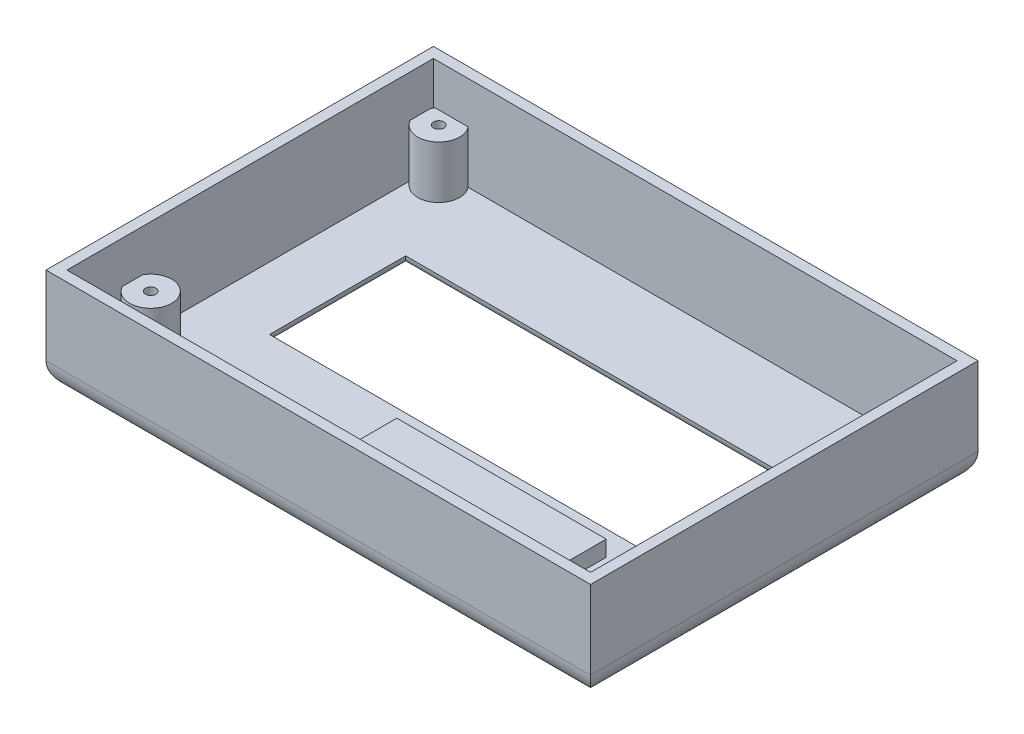
from build123d import *

# Parameters (mm, degrees)
SKETCH1_W           = 104
SKETCH1_H           = 74
SKETCH1_W_2         = 100
SKETCH1_H_2         = 70
BOSS_EXTRUDE2_DEPTH = 20
SKETCH1_3_W         = 100
SKETCH1_3_H         = 70
SKETCH1_3_R         = 5.5
SKETCH1_3_W_2       = 77
SKETCH1_3_H_2       = 26
BOSS_EXTRUDE3_DEPTH = 2
FILLET1_R           = 5
FILLET2_R           = 2
SKETCH3_R           = 4
SKETCH3_R_2         = 1
BOSS_EXTRUDE4_DEPTH = 10
SKETCH4_W           = 40
SKETCH4_H           = 3
BOSS_EXTRUDE5_DEPTH = 15


with BuildPart() as part:
    # Sketch1 → Boss-Extrude2 (new body)
    with BuildSketch(Plane(origin=(0, 0, 0), x_dir=(1, 0, 0), z_dir=(0, 1, 0))):
        with Locations((-31.943816067, -36.302599947)):
            Rectangle(SKETCH1_W, SKETCH1_H)
        with Locations((-31.943816067, -36.302599947)):
            Rectangle(SKETCH1_W_2, SKETCH1_H_2, mode=Mode.SUBTRACT)
    extrude(amount=BOSS_EXTRUDE2_DEPTH)

    # Sketch1<3> → Boss-Extrude3 (add)
    with BuildSketch(Plane(origin=(0, 0, 0), x_dir=(1, 0, 0), z_dir=(0, 1, 0))):
        with Locations((-31.943816067, -36.302599947)):
            Rectangle(SKETCH1_3_W, SKETCH1_3_H)
        with Locations(Location((-1.943816067, -61.302599947, 0), (0, 0, 270))):
            Circle(SKETCH1_3_R, mode=Mode.SUBTRACT)
        with Locations(Location((-26.943816067, -61.302599947, 0), (0, 0, 270))):
            Circle(SKETCH1_3_R, mode=Mode.SUBTRACT)
        with Locations((-31.443816067, -31.602599947)):
            Rectangle(SKETCH1_3_W_2, SKETCH1_3_H_2, mode=Mode.SUBTRACT)
    extrude(amount=BOSS_EXTRUDE3_DEPTH)

    # Fillet1
    fillet1_edges = [part.edges().sort_by_distance(p)[0] for p in [
        (-83.943816067, 0, 36.302599947),
        (-31.943816067, 0, 73.302599947),
        (20.056183933, 0, 36.302599947),
        (-31.943816067, 0, -0.697400053),
    ]]
    fillet(fillet1_edges, radius=FILLET1_R)

    # Fillet2
    fillet2_edges = [part.edges().sort_by_distance(p)[0] for p in [
        (-69.943816067, 0, 31.602599947),
        (-31.443816067, 0, 44.602599947),
        (7.056183933, 0, 31.602599947),
        (-31.443816067, 0, 18.602599947),
    ]]
    fillet(fillet2_edges, radius=FILLET2_R - 0.0001)  # a hair under: the kernel refuses the full size

    # Sketch3 → Boss-Extrude4 (add)
    # profile 1 of 4: a face of its own
    with BuildSketch(Plane(origin=(0, 2, 0), x_dir=(1, 0, 0), z_dir=(0, 1, 0))):
        with Locations((-78.443816067, -3.802599947)):
            Circle(SKETCH3_R)
        with Locations(Location((-78.443816067, -3.802599947, 0), (0, 0, 270))):
            Circle(SKETCH3_R_2, mode=Mode.SUBTRACT)
    # profile 2 of 4: a face of its own
    with BuildSketch(Plane(origin=(0, 2, 0), x_dir=(1, 0, 0), z_dir=(0, 1, 0))):
        with Locations((14.556183933, -3.802599947)):
            Circle(SKETCH3_R)
        with Locations(Location((14.556183933, -3.802599947, 0), (0, 0, 270))):
            Circle(SKETCH3_R_2, mode=Mode.SUBTRACT)
    # profile 3 of 4: a face of its own
    with BuildSketch(Plane(origin=(0, 2, 0), x_dir=(1, 0, 0), z_dir=(0, 1, 0))):
        with Locations((-78.443816067, -58.802599947)):
            Circle(SKETCH3_R)
        with Locations(Location((-78.443816067, -58.802599947, 0), (0, 0, 270))):
            Circle(SKETCH3_R_2, mode=Mode.SUBTRACT)
    # profile 4 of 4: a face of its own
    with BuildSketch(Plane(origin=(0, 2, 0), x_dir=(1, 0, 0), z_dir=(0, 1, 0))):
        with Locations((14.556183933, -58.802599947)):
            Circle(SKETCH3_R)
        with Locations(Location((14.556183933, -58.802599947, 0), (0, 0, 270))):
            Circle(SKETCH3_R_2, mode=Mode.SUBTRACT)
    extrude(amount=BOSS_EXTRUDE4_DEPTH)

    # Sketch4 → Boss-Extrude5 (add)
    with BuildSketch(Plane(origin=(0, 0, 71.302599947), x_dir=(-1, 0, 0), z_dir=(0, 0, -1))):
        with Locations((13.943816067, 10.5)):
            Rectangle(SKETCH4_W, SKETCH4_H)
    extrude(amount=BOSS_EXTRUDE5_DEPTH)


solid = part.part
